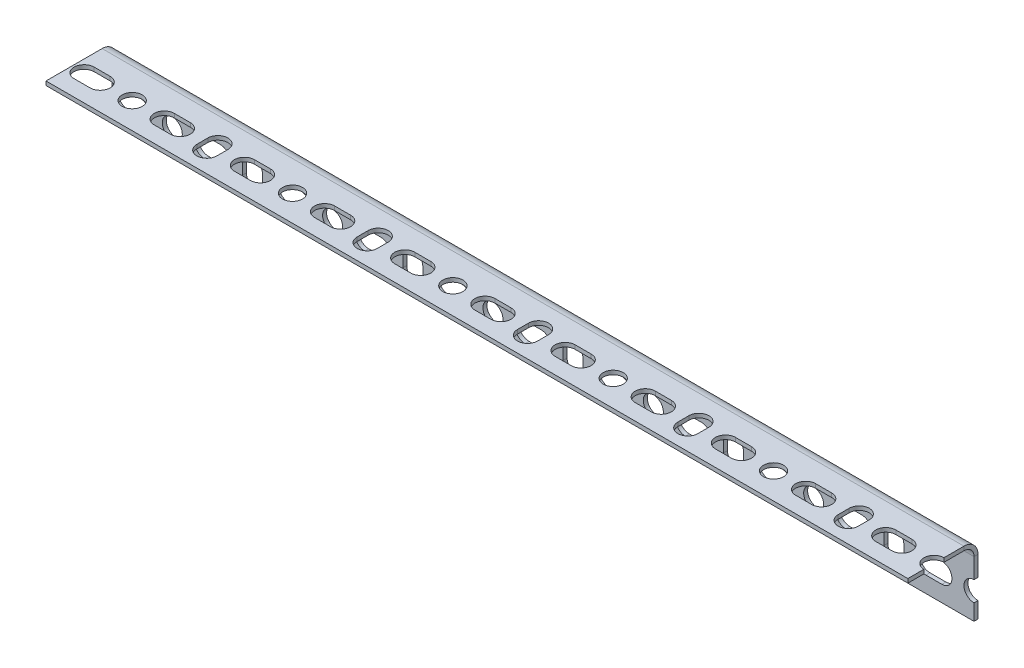
from build123d import *

# Parameters (mm, degrees)
SKETCH1_W                    = 430
SKETCH1_H                    = 2
BASE_FLANGE1_DEPTH           = 35
EDGE_FLANGE1_STRIP_W         = 18
EDGE_FLANGE1_STRIP_H         = 2
EDGE_FLANGE1_STRIP_CUT_DEPTH = 430
EDGE_FLANGE1_DEPTH           = 430
SKETCH11_R                   = 5
CUT_EXTRUDE1_DEPTH           = 221.624114729
LPATTERN1_COUNT              = 14
LPATTERN1_PITCH              = 80
SKETCH12_R                   = 5
CUT_EXTRUDE2_DEPTH           = 35
LPATTERN2_COUNT              = 15
LPATTERN2_PITCH              = 80


# Sheet-metal steps are written as plain solids
with BuildPart() as part:
    # Sketch1 → Base-Flange1 (new body)
    with BuildSketch(Plane(origin=(0, 0, 0), x_dir=(1, 0, 0), z_dir=(0, 1, 0))):
        with Locations((0, -1)):
            Rectangle(SKETCH1_W, SKETCH1_H)
    extrude(amount=BASE_FLANGE1_DEPTH)

    # Edge-Flange1 strip (across the edge) → Edge-Flange1 strip cut (cut)
    with BuildSketch(Plane(origin=(215, 35, 2), x_dir=(0, -1, 0), z_dir=(-1, 0, 0))):
        with Locations((-2, -1)):
            Rectangle(EDGE_FLANGE1_STRIP_W, EDGE_FLANGE1_STRIP_H)
    extrude(amount=EDGE_FLANGE1_STRIP_CUT_DEPTH, mode=Mode.SUBTRACT)

    # Edge-Flange1 section (across the edge) → Edge-Flange1 (add)
    with BuildSketch(Plane(origin=(215, 35, 2), x_dir=(0, -1, 0), z_dir=(-1, 0, 0))):
        with BuildLine():
            Line((0, 5), (0, 33))
            Line((0, 33), (2, 33))
            Line((2, 33), (2, 5))
            ThreePointArc((2, 5), (3.464466094, 1.464466094), (7, 0))
            Line((7, 0), (7, -2))
            ThreePointArc((7, -2), (2.050252532, 0.050252532), (0, 5))
        make_face()
    extrude(amount=EDGE_FLANGE1_DEPTH)

    # Sketch11 → Cut-Extrude1 (cut, through all)
    with BuildSketch(Plane(origin=(0, 35, 0), x_dir=(1, 0, 0), z_dir=(0, 1, 0))):
        with Locations((215, -22)):
            Circle(SKETCH11_R)
        with BuildLine():
            Line((199, -27), (191, -27))
            ThreePointArc((191, -27), (186, -22), (191, -17))
            Line((191, -17), (199, -17))
            ThreePointArc((199, -17), (204, -22), (199, -27))
        make_face()
        with BuildLine():
            Line((159, -27), (151, -27))
            ThreePointArc((151, -27), (146, -22), (151, -17))
            Line((151, -17), (159, -17))
            ThreePointArc((159, -17), (164, -22), (159, -27))
        make_face()
        with BuildLine():
            Line((170, -24.75), (170, -19.25))
            ThreePointArc((170, -19.25), (175, -14.25), (180, -19.25))
            Line((180, -19.25), (180, -24.75))
            ThreePointArc((180, -24.75), (175, -29.75), (170, -24.75))
        make_face()
    cut_extrude1 = extrude(amount=-CUT_EXTRUDE1_DEPTH, mode=Mode.SUBTRACT)

    # LPattern1: Cut-Extrude1 ×14
    with Locations(*[(-i * LPATTERN1_PITCH, 0, 0) for i in range(1, LPATTERN1_COUNT)]):
        add(cut_extrude1, mode=Mode.SUBTRACT)

    # Sketch12 → Cut-Extrude2 (cut)
    with BuildSketch(Plane.XY.offset(2)):
        with Locations((215, 13)):
            Circle(SKETCH12_R)
        with BuildLine():
            Line((199, 8), (191, 8))
            ThreePointArc((191, 8), (186, 13), (191, 18))
            Line((191, 18), (199, 18))
            ThreePointArc((199, 18), (204, 13), (199, 8))
        make_face()
        with BuildLine():
            Line((170, 10.25), (170, 15.75))
            ThreePointArc((170, 15.75), (175, 20.75), (180, 15.75))
            Line((180, 15.75), (180, 10.25))
            ThreePointArc((180, 10.25), (175, 5.25), (170, 10.25))
        make_face()
        with BuildLine():
            Line((159, 8), (151, 8))
            ThreePointArc((151, 8), (146, 13), (151, 18))
            Line((151, 18), (159, 18))
            ThreePointArc((159, 18), (164, 13), (159, 8))
        make_face()
    cut_extrude2 = extrude(amount=-CUT_EXTRUDE2_DEPTH, mode=Mode.SUBTRACT)

    # LPattern2: Cut-Extrude2 ×15
    with Locations(*[(-i * LPATTERN2_PITCH, 0, 0) for i in range(1, LPATTERN2_COUNT)]):
        add(cut_extrude2, mode=Mode.SUBTRACT)


solid = part.part
